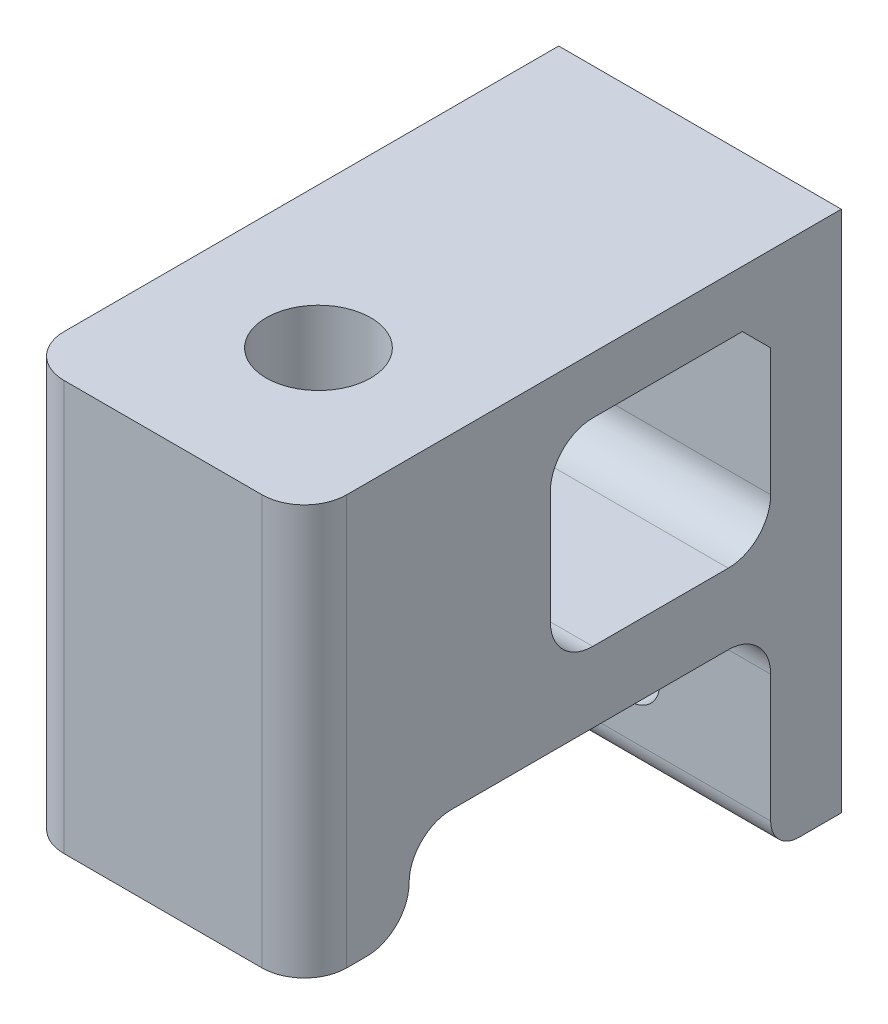
from build123d import *

# Parameters (mm, degrees)
SKETCH1_W           = 20
SKETCH1_H           = 33
SKETCH1_R           = 2.15
BOSS_EXTRUDE1_DEPTH = 5
SKETCH2_W           = 20
SKETCH2_H           = 4
BOSS_EXTRUDE2_DEPTH = 38
SKETCH4_W           = 20
SKETCH4_H           = 7.411842069
BOSS_EXTRUDE3_DEPTH = 25
FILLET1_R           = 3
FILLET2_R           = 2
FILLET4_R           = 3
CHAMFER2_SIZE       = 2
SKETCH8_W           = 20
SKETCH8_H           = 5
BOSS_EXTRUDE5_DEPTH = 25.588157931
FILLET7_R           = 3
SKETCH12_W          = 20
SKETCH12_H          = 10
BOSS_EXTRUDE6_DEPTH = 14
SKETCH3_R           = 3.7
CUT_EXTRUDE2_DEPTH  = 15
FILLET8_R           = 3


with BuildPart() as part:
    # Sketch1 → Boss-Extrude1 (new body)
    with BuildSketch(Plane.XY):
        with Locations((10, -16.5)):
            Rectangle(SKETCH1_W, SKETCH1_H)
        with Locations((10, -6.5)):
            Circle(SKETCH1_R, mode=Mode.SUBTRACT)
        with Locations(Location((10, -26.5, 0), (0, 0, 180))):
            Circle(SKETCH1_R, mode=Mode.SUBTRACT)
    extrude(amount=BOSS_EXTRUDE1_DEPTH)

    # Sketch2 → Boss-Extrude2 (add)
    with BuildSketch(Plane(origin=(0, 0, 0), x_dir=(-1, 0, 0), z_dir=(0, 0, -1))):
        with Locations((-10, 2)):
            Rectangle(SKETCH2_W, SKETCH2_H)
    extrude(amount=-BOSS_EXTRUDE2_DEPTH)

    # Sketch4 → Boss-Extrude3 (add)
    with BuildSketch(Plane.XZ):
        with Locations((10, 34.294078965)):
            Rectangle(SKETCH4_W, SKETCH4_H)
    extrude(amount=BOSS_EXTRUDE3_DEPTH)

    # Fillet1
    fillet1_edges = [part.edges().sort_by_distance(p)[0] for p in [
        (20, -10.5, 38),
        (0, -10.5, 38),
    ]]
    fillet(fillet1_edges, radius=FILLET1_R)

    # Fillet2
    fillet2_edges = [part.edges().sort_by_distance(p)[0] for p in [
        (10, -33, 5),
    ]]
    fillet(fillet2_edges, radius=FILLET2_R)

    # Fillet4
    fillet4_edges = [part.edges().sort_by_distance(p)[0] for p in [
        (10, -25, 30.588157931),
    ]]
    fillet(fillet4_edges, radius=FILLET4_R)

    # Chamfer2
    chamfer2_edges = [part.edges().sort_by_distance(p)[0] for p in [
        (10, 0, 5),
    ]]
    chamfer(chamfer2_edges, length=CHAMFER2_SIZE)

    # Sketch8 → Boss-Extrude5 (add)
    with BuildSketch(Plane.XY.offset(5)):
        with Locations((10, -16.5)):
            Rectangle(SKETCH8_W, SKETCH8_H)
    extrude(amount=BOSS_EXTRUDE5_DEPTH)

    # Fillet7
    fillet7_edges = [part.edges().sort_by_distance(p)[0] for p in [
        (10, -19, 5),
        (10, -19, 30.588157931),
        (10, -14, 5),
    ]]
    fillet(fillet7_edges, radius=FILLET7_R - 0.0001)  # a hair under: the kernel refuses the full size

    # Sketch12 → Boss-Extrude6 (add)
    with BuildSketch(Plane(origin=(0, -14, 0), x_dir=(1, 0, 0), z_dir=(0, 1, 0))):
        with Locations((10, -25.588157931)):
            Rectangle(SKETCH12_W, SKETCH12_H)
    extrude(amount=BOSS_EXTRUDE6_DEPTH)

    # Sketch3 → Cut-Extrude2 (cut)
    with BuildSketch(Plane(origin=(0, 4, 0), x_dir=(1, 0, 0), z_dir=(0, 1, 0))):
        with Locations(Location((10, -27, 0), (0, 0, 270))):
            Circle(SKETCH3_R)
    extrude(amount=-CUT_EXTRUDE2_DEPTH, mode=Mode.SUBTRACT)

    # Fillet8
    fillet8_edges = [part.edges().sort_by_distance(p)[0] for p in [
        (10, 0, 20.588157931),
        (10, -14, 20.588157931),
    ]]
    fillet(fillet8_edges, radius=FILLET8_R)


solid = part.part
